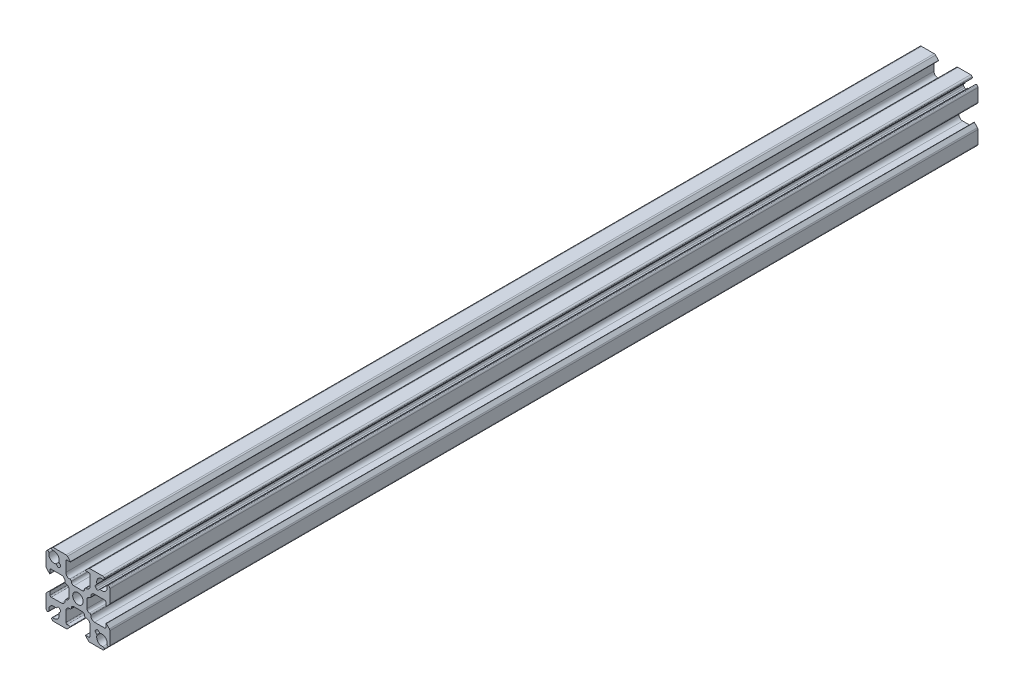
from build123d import *

# Parameters (mm, degrees)
SKETCH1_R                           = 2.08
BOSS_EXTRUDE1_DEPTH                 = 172.5549
SKETCH2_W                           = 3.2
SKETCH2_H                           = 16.3
F_6_4_6_4_DIAMETER_HOLE1_AT_2_COUNT = 2
F_6_4_6_4_DIAMETER_HOLE1_AT_2_PITCH = 120
F_6_4_6_4_DIAMETER_HOLE1_AT_3_COUNT = 2
F_6_4_6_4_DIAMETER_HOLE1_AT_3_PITCH = 240


with BuildPart() as part:
    # Sketch1 → Boss-Extrude1 (new, symmetric)
    with BuildSketch(Plane(origin=(0, 0, 0), x_dir=(-1, 0, 0), z_dir=(0, 0, -1))):
        with BuildLine():
            Line((-7.48853247, 8.61990332), (-6.985643798, 8.117014648))
            ThreePointArc((-6.985643798, 8.117014648), (-6.839197188, 7.763461257), (-6.985643798, 7.409907866))
            Line((-6.985643798, 7.409907866), (-7.409907866, 6.985643798))
            ThreePointArc((-7.409907866, 6.985643798), (-7.763461257, 6.839197188), (-8.117014648, 6.985643798))
            Line((-8.117014648, 6.985643798), (-8.61990332, 7.48853247))
            ThreePointArc((-8.61990332, 7.48853247), (-8.738774884, 7.554957329), (-8.874825936, 7.549228331))
            ThreePointArc((-8.874825936, 7.549228331), (-10.889377278, 7.955008076), (-11.572136222, 9.893284252))
            ThreePointArc((-11.572136222, 9.893284252), (-11.766795458, 10.383720777), (-12.292708824, 10.42656157))
            ThreePointArc((-12.292708824, 10.42656157), (-12.590129525, 10.150252615), (-12.7, 9.759440396))
            Line((-12.7, 9.759440396), (-12.7, 4.710660172))
            ThreePointArc((-12.7, 4.710660172), (-12.642909649, 4.423647598), (-12.480330086, 4.180330086))
            Line((-12.480330086, 4.180330086), (-11.270710678, 2.970710678))
            ThreePointArc((-11.270710678, 2.970710678), (-11.161731657, 2.949033403), (-11.1, 3.041421356))
            Line((-11.1, 3.041421356), (-11.1, 4.325))
            ThreePointArc((-11.1, 4.325), (-10.953553391, 4.678553391), (-10.6, 4.825))
            Line((-10.6, 4.825), (-6.6, 4.825))
            ThreePointArc((-6.6, 4.825), (-5.539339828, 4.385660172), (-5.1, 3.325))
            Line((-5.1, 3.325), (-5.1, 3.15))
            ThreePointArc((-5.1, 3.15), (-4.953553391, 2.796446609), (-4.6, 2.65))
            ThreePointArc((-4.6, 2.65), (-3.892893219, 2.357106781), (-3.6, 1.65))
            Line((-3.6, 1.65), (-3.6, -1.65))
            ThreePointArc((-3.6, -1.65), (-3.892893219, -2.357106781), (-4.6, -2.65))
            ThreePointArc((-4.6, -2.65), (-4.953553391, -2.796446609), (-5.1, -3.15))
            Line((-5.1, -3.15), (-5.1, -3.325))
            ThreePointArc((-5.1, -3.325), (-5.539339828, -4.385660172), (-6.6, -4.825))
            Line((-6.6, -4.825), (-10.6, -4.825))
            ThreePointArc((-10.6, -4.825), (-10.953553391, -4.678553391), (-11.1, -4.325))
            Line((-11.1, -4.325), (-11.1, -3.041421356))
            ThreePointArc((-11.1, -3.041421356), (-11.161731657, -2.949033403), (-11.270710678, -2.970710678))
            Line((-11.270710678, -2.970710678), (-12.480330086, -4.180330086))
            ThreePointArc((-12.480330086, -4.180330086), (-12.642909649, -4.423647598), (-12.7, -4.710660172))
            Line((-12.7, -4.710660172), (-12.7, -9.759440396))
            ThreePointArc((-12.7, -9.759440396), (-12.590129525, -10.150252615), (-12.292708824, -10.42656157))
            ThreePointArc((-12.292708824, -10.42656157), (-11.766795458, -10.383720777), (-11.572136222, -9.893284252))
            ThreePointArc((-11.572136222, -9.893284252), (-10.889377278, -7.955008076), (-8.874825936, -7.549228331))
            ThreePointArc((-8.874825936, -7.549228331), (-8.738774884, -7.554957329), (-8.61990332, -7.48853247))
            Line((-8.61990332, -7.48853247), (-8.117014648, -6.985643798))
            ThreePointArc((-8.117014648, -6.985643798), (-7.763461257, -6.839197188), (-7.409907866, -6.985643798))
            Line((-7.409907866, -6.985643798), (-6.985643798, -7.409907866))
            ThreePointArc((-6.985643798, -7.409907866), (-6.839197188, -7.763461257), (-6.985643798, -8.117014648))
            Line((-6.985643798, -8.117014648), (-7.48853247, -8.61990332))
            ThreePointArc((-7.48853247, -8.61990332), (-7.554957329, -8.738774884), (-7.549228331, -8.874825936))
            ThreePointArc((-7.549228331, -8.874825936), (-7.955008076, -10.889377278), (-9.893284252, -11.572136222))
            ThreePointArc((-9.893284252, -11.572136222), (-10.383720777, -11.766795458), (-10.42656157, -12.292708824))
            ThreePointArc((-10.42656157, -12.292708824), (-10.150252615, -12.590129525), (-9.759440396, -12.7))
            Line((-9.759440396, -12.7), (-4.710660172, -12.7))
            ThreePointArc((-4.710660172, -12.7), (-4.423647598, -12.642909649), (-4.180330086, -12.480330086))
            Line((-4.180330086, -12.480330086), (-2.970710678, -11.270710678))
            ThreePointArc((-2.970710678, -11.270710678), (-2.949033403, -11.161731657), (-3.041421356, -11.1))
            Line((-3.041421356, -11.1), (-4.325, -11.1))
            ThreePointArc((-4.325, -11.1), (-4.678553391, -10.953553391), (-4.825, -10.6))
            Line((-4.825, -10.6), (-4.825, -6.6))
            ThreePointArc((-4.825, -6.6), (-4.385660172, -5.539339828), (-3.325, -5.1))
            Line((-3.325, -5.1), (-3.15, -5.1))
            ThreePointArc((-3.15, -5.1), (-2.796446609, -4.953553391), (-2.65, -4.6))
            ThreePointArc((-2.65, -4.6), (-2.357106781, -3.892893219), (-1.65, -3.6))
            Line((-1.65, -3.6), (1.65, -3.6))
            ThreePointArc((1.65, -3.6), (2.357106781, -3.892893219), (2.65, -4.6))
            ThreePointArc((2.65, -4.6), (2.796446609, -4.953553391), (3.15, -5.1))
            Line((3.15, -5.1), (3.325, -5.1))
            ThreePointArc((3.325, -5.1), (4.385660172, -5.539339828), (4.825, -6.6))
            Line((4.825, -6.6), (4.825, -10.6))
            ThreePointArc((4.825, -10.6), (4.678553391, -10.953553391), (4.325, -11.1))
            Line((4.325, -11.1), (3.041421356, -11.1))
            ThreePointArc((3.041421356, -11.1), (2.949033403, -11.161731657), (2.970710678, -11.270710678))
            Line((2.970710678, -11.270710678), (4.180330086, -12.480330086))
            ThreePointArc((4.180330086, -12.480330086), (4.423647598, -12.642909649), (4.710660172, -12.7))
            Line((4.710660172, -12.7), (9.759440396, -12.7))
            ThreePointArc((9.759440396, -12.7), (10.150252615, -12.590129525), (10.42656157, -12.292708824))
            ThreePointArc((10.42656157, -12.292708824), (10.383720777, -11.766795458), (9.893284252, -11.572136222))
            ThreePointArc((9.893284252, -11.572136222), (7.955008076, -10.889377278), (7.549228331, -8.874825936))
            ThreePointArc((7.549228331, -8.874825936), (7.554957329, -8.738774884), (7.48853247, -8.61990332))
            Line((7.48853247, -8.61990332), (6.985643798, -8.117014648))
            ThreePointArc((6.985643798, -8.117014648), (6.839197188, -7.763461257), (6.985643798, -7.409907866))
            Line((6.985643798, -7.409907866), (7.409907866, -6.985643798))
            ThreePointArc((7.409907866, -6.985643798), (7.763461257, -6.839197188), (8.117014648, -6.985643798))
            Line((8.117014648, -6.985643798), (8.61990332, -7.48853247))
            ThreePointArc((8.61990332, -7.48853247), (8.738774884, -7.554957329), (8.874825936, -7.549228331))
            ThreePointArc((8.874825936, -7.549228331), (10.889377278, -7.955008076), (11.572136222, -9.893284252))
            ThreePointArc((11.572136222, -9.893284252), (11.766795458, -10.383720777), (12.292708824, -10.42656157))
            ThreePointArc((12.292708824, -10.42656157), (12.590129525, -10.150252615), (12.7, -9.759440396))
            Line((12.7, -9.759440396), (12.7, -4.710660172))
            ThreePointArc((12.7, -4.710660172), (12.642909649, -4.423647598), (12.480330086, -4.180330086))
            Line((12.480330086, -4.180330086), (11.270710678, -2.970710678))
            ThreePointArc((11.270710678, -2.970710678), (11.161731657, -2.949033403), (11.1, -3.041421356))
            Line((11.1, -3.041421356), (11.1, -4.325))
            ThreePointArc((11.1, -4.325), (10.953553391, -4.678553391), (10.6, -4.825))
            Line((10.6, -4.825), (6.6, -4.825))
            ThreePointArc((6.6, -4.825), (5.539339828, -4.385660172), (5.1, -3.325))
            Line((5.1, -3.325), (5.1, -3.15))
            ThreePointArc((5.1, -3.15), (4.953553391, -2.796446609), (4.6, -2.65))
            ThreePointArc((4.6, -2.65), (3.892893219, -2.357106781), (3.6, -1.65))
            Line((3.6, -1.65), (3.6, 1.65))
            ThreePointArc((3.6, 1.65), (3.892893219, 2.357106781), (4.6, 2.65))
            ThreePointArc((4.6, 2.65), (4.953553391, 2.796446609), (5.1, 3.15))
            Line((5.1, 3.15), (5.1, 3.325))
            ThreePointArc((5.1, 3.325), (5.539339828, 4.385660172), (6.6, 4.825))
            Line((6.6, 4.825), (10.6, 4.825))
            ThreePointArc((10.6, 4.825), (10.953553391, 4.678553391), (11.1, 4.325))
            Line((11.1, 4.325), (11.1, 3.041421356))
            ThreePointArc((11.1, 3.041421356), (11.161731657, 2.949033403), (11.270710678, 2.970710678))
            Line((11.270710678, 2.970710678), (12.480330086, 4.180330086))
            ThreePointArc((12.480330086, 4.180330086), (12.642909649, 4.423647598), (12.7, 4.710660172))
            Line((12.7, 4.710660172), (12.7, 9.759440396))
            ThreePointArc((12.7, 9.759440396), (12.590129525, 10.150252615), (12.292708824, 10.42656157))
            ThreePointArc((12.292708824, 10.42656157), (11.766795458, 10.383720777), (11.572136222, 9.893284252))
            ThreePointArc((11.572136222, 9.893284252), (10.889377278, 7.955008076), (8.874825936, 7.549228331))
            ThreePointArc((8.874825936, 7.549228331), (8.738774884, 7.554957329), (8.61990332, 7.48853247))
            Line((8.61990332, 7.48853247), (8.117014648, 6.985643798))
            ThreePointArc((8.117014648, 6.985643798), (7.763461257, 6.839197188), (7.409907866, 6.985643798))
            Line((7.409907866, 6.985643798), (6.985643798, 7.409907866))
            ThreePointArc((6.985643798, 7.409907866), (6.839197188, 7.763461257), (6.985643798, 8.117014648))
            Line((6.985643798, 8.117014648), (7.48853247, 8.61990332))
            ThreePointArc((7.48853247, 8.61990332), (7.554957329, 8.738774884), (7.549228331, 8.874825936))
            ThreePointArc((7.549228331, 8.874825936), (7.955008076, 10.889377278), (9.893284252, 11.572136222))
            ThreePointArc((9.893284252, 11.572136222), (10.383720777, 11.766795458), (10.42656157, 12.292708824))
            ThreePointArc((10.42656157, 12.292708824), (10.150252615, 12.590129525), (9.759440396, 12.7))
            Line((9.759440396, 12.7), (4.710660172, 12.7))
            ThreePointArc((4.710660172, 12.7), (4.423647598, 12.642909649), (4.180330086, 12.480330086))
            Line((4.180330086, 12.480330086), (2.970710678, 11.270710678))
            ThreePointArc((2.970710678, 11.270710678), (2.949033403, 11.161731657), (3.041421356, 11.1))
            Line((3.041421356, 11.1), (4.325, 11.1))
            ThreePointArc((4.325, 11.1), (4.678553391, 10.953553391), (4.825, 10.6))
            Line((4.825, 10.6), (4.825, 6.6))
            ThreePointArc((4.825, 6.6), (4.385660172, 5.539339828), (3.325, 5.1))
            Line((3.325, 5.1), (3.15, 5.1))
            ThreePointArc((3.15, 5.1), (2.796446609, 4.953553391), (2.65, 4.6))
            ThreePointArc((2.65, 4.6), (2.357106781, 3.892893219), (1.65, 3.6))
            Line((1.65, 3.6), (-1.65, 3.6))
            ThreePointArc((-1.65, 3.6), (-2.357106781, 3.892893219), (-2.65, 4.6))
            ThreePointArc((-2.65, 4.6), (-2.796446609, 4.953553391), (-3.15, 5.1))
            Line((-3.15, 5.1), (-3.325, 5.1))
            ThreePointArc((-3.325, 5.1), (-4.385660172, 5.539339828), (-4.825, 6.6))
            Line((-4.825, 6.6), (-4.825, 10.6))
            ThreePointArc((-4.825, 10.6), (-4.678553391, 10.953553391), (-4.325, 11.1))
            Line((-4.325, 11.1), (-3.041421356, 11.1))
            ThreePointArc((-3.041421356, 11.1), (-2.949033403, 11.161731657), (-2.970710678, 11.270710678))
            Line((-2.970710678, 11.270710678), (-4.180330086, 12.480330086))
            ThreePointArc((-4.180330086, 12.480330086), (-4.423647598, 12.642909649), (-4.710660172, 12.7))
            Line((-4.710660172, 12.7), (-9.759440396, 12.7))
            ThreePointArc((-9.759440396, 12.7), (-10.150252615, 12.590129525), (-10.42656157, 12.292708824))
            ThreePointArc((-10.42656157, 12.292708824), (-10.383720777, 11.766795458), (-9.893284252, 11.572136222))
            ThreePointArc((-9.893284252, 11.572136222), (-7.955008076, 10.889377278), (-7.549228331, 8.874825936))
            ThreePointArc((-7.549228331, 8.874825936), (-7.554957329, 8.738774884), (-7.48853247, 8.61990332))
        make_face()
        Circle(SKETCH1_R, mode=Mode.SUBTRACT)
    extrude(amount=BOSS_EXTRUDE1_DEPTH, both=True)

    # Sketch2 → Ø6.4 (6.4) Diameter Hole1 (revolve, cut)
    with BuildSketch(Plane(origin=(3.6, 0, 132.55489999), x_dir=(0, 0, -1), z_dir=(0, 1, 0))):
        with Locations((1.6, 8.15)):
            Rectangle(SKETCH2_W, SKETCH2_H)
    f_6_4_6_4_diameter_hole1 = revolve(axis=Axis((9.95, 0, 132.55489999), (-1, 0, 0)), mode=Mode.SUBTRACT)

    # Ø6.4 (6.4) Diameter Hole1 at 2: Ø6.4 (6.4) Diameter Hole1 ×2
    with Locations(*[(0, 0, -i * F_6_4_6_4_DIAMETER_HOLE1_AT_2_PITCH) for i in range(1, F_6_4_6_4_DIAMETER_HOLE1_AT_2_COUNT)]):
        add(f_6_4_6_4_diameter_hole1, mode=Mode.SUBTRACT)

    # Ø6.4 (6.4) Diameter Hole1 at 3: Ø6.4 (6.4) Diameter Hole1 ×2
    with Locations(*[(0, 0, -i * F_6_4_6_4_DIAMETER_HOLE1_AT_3_PITCH) for i in range(1, F_6_4_6_4_DIAMETER_HOLE1_AT_3_COUNT)]):
        add(f_6_4_6_4_diameter_hole1, mode=Mode.SUBTRACT)


solid = part.part
